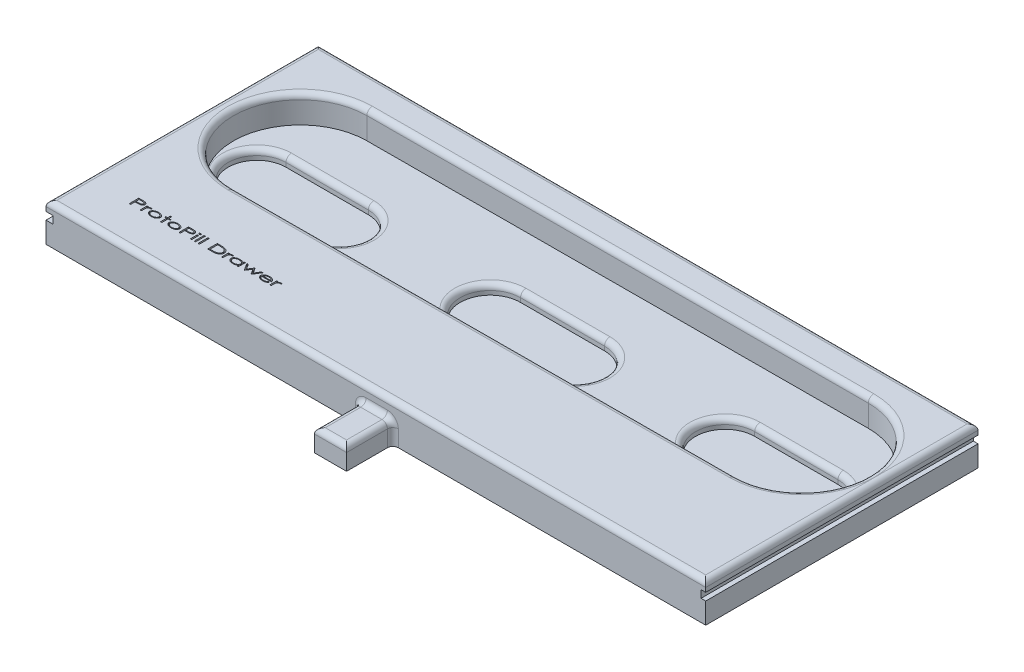
from build123d import *

# Parameters (mm, degrees)
SKETCH1_W           = 242.10193191
SKETCH1_H           = 93
BOSS_EXTRUDE1_DEPTH = 14
SKETCH2_W           = 4.694067914
SKETCH2_H           = 2.762668825
CUT_EXTRUDE1_DEPTH  = 262.793762442
SKETCH7_W           = 11.788952715
SKETCH7_H           = 7.980899871
BOSS_EXTRUDE2_DEPTH = 70
BOSS_EXTRUDE3_DEPTH = 53
CUT_EXTRUDE2_DEPTH  = 10
CUT_EXTRUDE4_DEPTH  = 3.5
FILLET2_R           = 2
FILLET3_R           = 2
SKETCH11_W          = 242.10193191
SKETCH11_H          = 46.073783244
CUT_EXTRUDE5_DEPTH  = 264.730454648
FILLET4_R           = 2
SKETCH12_R          = 3.025
CUT_EXTRUDE6_DEPTH  = 2
SKETCH13_W          = 0.493589743
SKETCH13_H          = 2.557692308
SKETCH13_H_2        = 3.58974359
CUT_EXTRUDE7_DEPTH  = 2
CUT_EXTRUDE8_DEPTH  = 2


with BuildPart() as part:
    # Sketch1 → Boss-Extrude1 (new body)
    with BuildSketch(Plane(origin=(0, 0, 0), x_dir=(1, 0, 0), z_dir=(0, 1, 0))):
        with Locations((123.266397435, 18.180222461)):
            Rectangle(SKETCH1_W, SKETCH1_H)
    extrude(amount=BOSS_EXTRUDE1_DEPTH)

    # Sketch2 → Cut-Extrude1 (cut, through all)
    with BuildSketch(Plane.XY.offset(28.319777539)):
        with Locations((2.347033957, 9.071542246)):
            Rectangle(SKETCH2_W, SKETCH2_H)
    cut_extrude1 = extrude(amount=-CUT_EXTRUDE1_DEPTH, mode=Mode.SUBTRACT)

    # Mirror5: Cut-Extrude1 across plane
    add(cut_extrude1.mirror(Plane(origin=(123.647335387, 0, 0), x_dir=(0, 0, 1), z_dir=(1, 0, 0))), mode=Mode.SUBTRACT)

    # Sketch7 → Boss-Extrude2 (add)
    with BuildSketch(Plane.XY.offset(28.319777539)):
        with Locations((123.619253178, 3.990449936)):
            Rectangle(SKETCH7_W, SKETCH7_H)
    extrude(amount=BOSS_EXTRUDE2_DEPTH)

    # Sketch8 → Boss-Extrude3 (add)
    with BuildSketch(Plane.XY.offset(28.319777539)):
        Polygon((244.31736339, 10.452876658), (244.31736339, 14), (2.21543148, 14), (2.21543148, 10.452876658), (4.694067914, 10.452876658), (4.694067914, 7.690207833), (2.21543148, 7.690207833), (2.21543148, 0), (117.72477682, 0), (117.72477682, 7.980899871), (129.513729535, 7.980899871), (129.513729535, 0), (244.31736339, 0), (244.31736339, 7.690207833), (242.60060286, 7.690207833), (242.60060286, 10.452876658), align=None)
    extrude(amount=BOSS_EXTRUDE3_DEPTH)

    # Sketch9 → Cut-Extrude2 (cut)
    with BuildSketch(Plane(origin=(0, 14, 0), x_dir=(1, 0, 0), z_dir=(0, 1, 0))):
        with BuildLine():
            Line((32.192967626, 6.462131645), (215.586098008, 7.089792499))
            ThreePointArc((215.586098008, 7.089792499), (240.21687673, -17.37296417), (215.754120062, -42.003742891))
            Line((215.754120062, -42.003742891), (32.360989679, -42.631403746))
            ThreePointArc((32.360989679, -42.631403746), (7.730210957, -18.168647077), (32.192967626, 6.462131645))
        make_face()
    extrude(amount=-CUT_EXTRUDE2_DEPTH, mode=Mode.SUBTRACT)

    # Sketch10 → Cut-Extrude4 (cut)
    with BuildSketch(Plane(origin=(0, 4, 0), x_dir=(1, 0, 0), z_dir=(0, 1, 0))):
        with BuildLine():
            Line((22.25591728, -13.271336062), (52.471076918, -13.271336062))
            ThreePointArc((52.471076918, -13.271336062), (63.102678482, -23.902937626), (52.471076918, -34.53453919))
            Line((52.471076918, -34.53453919), (22.25591728, -34.53453919))
            ThreePointArc((22.25591728, -34.53453919), (11.624315716, -23.902937626), (22.25591728, -13.271336062))
        make_face()
        with BuildLine():
            Line((108.253612411, -13.200304135), (139.069681283, -13.200304135))
            ThreePointArc((139.069681283, -13.200304135), (150.155917287, -24.286540139), (139.069681283, -35.372776144))
            Line((139.069681283, -35.372776144), (108.253612411, -35.372776144))
            ThreePointArc((108.253612411, -35.372776144), (97.167376406, -24.286540139), (108.253612411, -13.200304135))
        make_face()
        with BuildLine():
            Line((193.804446674, -12.815543396), (224.338324214, -12.815543396))
            ThreePointArc((224.338324214, -12.815543396), (235.209291929, -23.686511111), (224.338324214, -34.557478826))
            Line((224.338324214, -34.557478826), (193.804446674, -34.557478826))
            ThreePointArc((193.804446674, -34.557478826), (182.933478959, -23.686511111), (193.804446674, -12.815543396))
        make_face()
    extrude(amount=-CUT_EXTRUDE4_DEPTH, mode=Mode.SUBTRACT)

    # Fillet2
    fillet2_edges = [part.edges().sort_by_distance(p)[0] for p in [
        (240.21687673, 14, 17.37296417),
        (124.05755487, 14, 42.317573318),
        (7.730210957, 14, 18.168647077),
        (123.889532817, 14, -6.775962072),
    ]]
    fillet(fillet2_edges, radius=FILLET2_R)

    # Fillet3
    fillet3_edges = [part.edges().sort_by_distance(p)[0] for p in [
        (235.209291929, 4, 23.686511111),
        (209.071385444, 4, 34.557478826),
        (182.933478959, 4, 23.686511111),
        (150.155917287, 4, 24.286540139),
        (123.661646847, 4, 35.372776144),
        (97.167376406, 4, 24.286540139),
        (63.102678482, 4, 23.902937626),
        (37.363497099, 4, 34.53453919),
        (11.624315716, 4, 23.902937626),
        (209.071385444, 4, 12.815543396),
        (123.661646847, 4, 13.200304135),
        (37.363497099, 4, 13.271336062),
    ]]
    fillet(fillet3_edges, radius=FILLET3_R)

    # Sketch11 → Cut-Extrude5 (cut, through all)
    with BuildSketch(Plane(origin=(0, 14, 0), x_dir=(1, 0, 0), z_dir=(0, 1, 0))):
        with Locations((123.266397435, 41.643330839)):
            Rectangle(SKETCH11_W, SKETCH11_H)
    extrude(amount=-CUT_EXTRUDE5_DEPTH, mode=Mode.SUBTRACT)

    # Fillet4
    fillet4_edges = [part.edges().sort_by_distance(p)[0] for p in [
        (117.72477682, 3.990449936, 81.319777539),
        (129.513729535, 3.990449936, 81.319777539),
        (123.619253178, 7.980899871, 98.319777539),
        (117.72477682, 7.980899871, 89.819777539),
        (123.619253178, 7.980899871, 81.319777539),
        (129.513729535, 7.980899871, 89.819777539),
        (244.31736339, 14, 31.356669161),
        (123.266397435, 14, 81.319777539),
        (2.21543148, 14, 31.356669161),
        (123.266397435, 14, -18.606439217),
    ]]
    fillet(fillet4_edges, radius=FILLET4_R)

    # Sketch12 → Cut-Extrude6 (cut)
    with BuildSketch(Plane.XZ):
        with Locations((79.20490952, -2.654606068)):
            Circle(SKETCH12_R)
        with Locations((79.20490952, 6.341887825)):
            Circle(SKETCH12_R)
        with Locations((169.858472383, 5.930696377)):
            Circle(SKETCH12_R)
        with Locations((169.858472383, -2.654606068)):
            Circle(SKETCH12_R)
    extrude(amount=-CUT_EXTRUDE6_DEPTH, mode=Mode.SUBTRACT)

    # Sketch13 → Cut-Extrude7 (cut)
    # profile 1 of 16: a face of its own
    with BuildSketch(Plane(origin=(0, 14, 0), x_dir=(1, 0, 0), z_dir=(0, 1, 0))):
        with BuildLine():
            Line((18.559453652, -63.609154928), (19.589401569, -63.609154928))
            add(Edge.make_bspline(
                [(19.589401569, -63.609154928), (19.660216229, -63.609207816), (19.796009129, -63.609309233), (19.990458636, -63.612311088), (20.166922514, -63.616339403), (20.325381855, -63.621986437), (20.465916911, -63.628417575), (20.588361196, -63.637854069), (20.692806826, -63.647360425), (20.75610385, -63.657252292), (20.784814229, -63.661739063)],
                knots=[0, 0, 0, 0, 1.419177856, 2.721389515, 3.89734153, 4.956527438, 5.899121513, 6.716361902, 7.417765099, 8, 8, 8, 8], degree=3))
            add(Edge.make_bspline(
                [(20.784814229, -63.661739063), (20.820887054, -63.668358554), (20.892034872, -63.681414432), (20.995514197, -63.707401431), (21.093930167, -63.738080351), (21.187023764, -63.77418744), (21.275308065, -63.814482055), (21.358419454, -63.860319671), (21.436467741, -63.910896585), (21.509168984, -63.965877922), (21.575105371, -64.025007934), (21.632608856, -64.088601838), (21.680831646, -64.15611131), (21.721857181, -64.226827444), (21.752422367, -64.301981747), (21.774235543, -64.380809711), (21.788083956, -64.463099368), (21.789502804, -64.519389326), (21.790222883, -64.547957011)],
                knots=[0, 0, 0, 0, 1.202944546, 2.372613736, 3.497786956, 4.582770442, 5.646275108, 6.679186854, 7.693607135, 8.694962411, 9.666642172, 10.595006966, 11.501456956, 12.383984799, 13.271030618, 14.154656858, 15.063470898, 16, 16, 16, 16], degree=3))
            add(Edge.make_bspline(
                [(21.790222883, -64.547957011), (21.789521087, -64.576761689), (21.788143787, -64.633291905), (21.774119081, -64.716000476), (21.752660293, -64.794872573), (21.722045447, -64.869807261), (21.683557714, -64.941214738), (21.635074098, -65.00797268), (21.578906649, -65.07163001), (21.513310562, -65.129978091), (21.440869989, -65.18484635), (21.361600897, -65.235229344), (21.275762005, -65.280811287), (21.183647001, -65.321492741), (21.0849146, -65.357142972), (20.979859337, -65.388653778), (20.867916227, -65.415337146), (20.790732781, -65.429180671), (20.751160383, -65.436278326)],
                knots=[0, 0, 0, 0, 0.922605917, 1.810647271, 2.681294701, 3.538296812, 4.399903948, 5.275180805, 6.177331378, 7.116219832, 8.084190562, 9.088028358, 10.12368074, 11.197019002, 12.313319958, 13.4865942, 14.711362353, 16, 16, 16, 16], degree=3))
            add(Edge.make_bspline(
                [(20.751160383, -65.436278326), (20.718469229, -65.440942875), (20.646706534, -65.451182363), (20.529050496, -65.462594348), (20.392284803, -65.472278622), (20.236346099, -65.479638048), (20.061053197, -65.485869185), (19.866368667, -65.490814558), (19.65227691, -65.493557666), (19.503164369, -65.493697388), (19.425339069, -65.493770313)],
                knots=[0, 0, 0, 0, 0.596701069, 1.309861314, 2.135550679, 3.074303209, 4.130845578, 5.305332262, 6.593590277, 8, 8, 8, 8], degree=3))
            Line((19.425339069, -65.493770313), (19.053043395, -65.493770313))
            Line((19.053043395, -65.493770313), (19.053043395, -67.109154928))
            Line((19.053043395, -67.109154928), (18.559453652, -67.109154928))
            Line((18.559453652, -67.109154928), (18.559453652, -63.609154928))
        make_face()
        with BuildLine():
            Line((19.053043395, -63.968129287), (19.053043395, -65.134795954))
            Line((19.053043395, -65.134795954), (19.953984902, -65.142508294))
            add(Edge.make_bspline(
                [(19.953984902, -65.142508294), (19.99792553, -65.142521334), (20.08301808, -65.142546588), (20.205949603, -65.138570661), (20.319804463, -65.134014923), (20.424328313, -65.127165764), (20.519658494, -65.117805993), (20.606116267, -65.108019692), (20.683188352, -65.094359518), (20.772402579, -65.075649298), (20.871574629, -65.044704061), (20.978955012, -64.998076538), (21.07224247, -64.940131325), (21.152027991, -64.873727987), (21.216190155, -64.800096138), (21.262354089, -64.720428976), (21.291409318, -64.636401283), (21.294894643, -64.578326983), (21.296633139, -64.549359255)],
                knots=[0, 0, 0, 0, 1.302178146, 2.521713123, 3.644833948, 4.679186471, 5.625468095, 6.483724746, 7.256908744, 7.944332482, 9.184328887, 10.328545311, 11.404879146, 12.427406377, 13.395044434, 14.282513672, 15.143309921, 16, 16, 16, 16], degree=3))
            add(Edge.make_bspline(
                [(21.296633139, -64.549359255), (21.29488017, -64.521086999), (21.291349857, -64.464149342), (21.26214629, -64.381617706), (21.216240367, -64.302719484), (21.151826402, -64.230387849), (21.074420468, -64.163622302), (20.983396781, -64.107713567), (20.881682484, -64.060904428), (20.787456502, -64.032245262), (20.703325252, -64.013994903), (20.629883554, -64.00148467), (20.546835613, -63.991071106), (20.454427444, -63.983061843), (20.352767544, -63.975873783), (20.2417168, -63.971162183), (20.121100984, -63.968331153), (20.037420139, -63.968198302), (19.993948844, -63.968129287)],
                knots=[0, 0, 0, 0, 0.85982624, 1.731608922, 2.638175506, 3.627963027, 4.668731374, 5.743984735, 6.872385735, 8.073309669, 8.737023245, 9.49590589, 10.343247817, 11.287432573, 12.322799246, 13.449422509, 14.675002546, 16, 16, 16, 16], degree=3))
            Line((19.993948844, -63.968129287), (19.053043395, -63.968129287))
        make_face(mode=Mode.SUBTRACT)
    # profile 2 of 16: a face of its own
    with BuildSketch(Plane(origin=(0, 14, 0), x_dir=(1, 0, 0), z_dir=(0, 1, 0))):
        with BuildLine():
            Line((22.553043395, -64.55146262), (23.046633139, -64.55146262))
            Line((23.046633139, -64.55146262), (23.046633139, -64.927965024))
            add(Edge.make_bspline(
                [(23.046633139, -64.927965024), (23.082885879, -64.892621444), (23.153638365, -64.823643314), (23.268351063, -64.735386097), (23.385694455, -64.662111951), (23.506193525, -64.604249484), (23.629883275, -64.560946567), (23.755528933, -64.528912548), (23.884155021, -64.510398001), (23.970654507, -64.507865291), (24.014181216, -64.506590826)],
                knots=[0, 0, 0, 0, 1.118950737, 2.183794828, 3.193525129, 4.173720819, 5.133313879, 6.087280825, 7.037516007, 8, 8, 8, 8], degree=3))
            add(Edge.make_bspline(
                [(24.014181216, -64.506590826), (24.047897414, -64.507756469), (24.116628327, -64.510132648), (24.221300531, -64.527311932), (24.329395531, -64.554260942), (24.400953974, -64.580679867), (24.43765878, -64.59423105)],
                knots=[0, 0, 0, 0, 0.930225898, 1.896277749, 2.920927934, 4, 4, 4, 4], degree=3))
            Line((24.43765878, -64.59423105), (24.180347081, -64.866266306))
            add(Edge.make_bspline(
                [(24.180347081, -64.866266306), (24.156566026, -64.8595064), (24.111129946, -64.846590924), (24.045503081, -64.831561132), (23.985450915, -64.822594083), (23.94736645, -64.821303889), (23.929345479, -64.82069339)],
                knots=[0, 0, 0, 0, 1.159041688, 2.214464814, 3.155112748, 4, 4, 4, 4], degree=3))
            add(Edge.make_bspline(
                [(23.929345479, -64.82069339), (23.889948104, -64.822308073), (23.811047254, -64.825541788), (23.694185274, -64.85207983), (23.579705378, -64.894632173), (23.487625223, -64.943250947), (23.416756228, -64.990378929), (23.366448084, -65.031120689), (23.31903889, -65.076135863), (23.275521831, -65.126404123), (23.234924036, -65.180976511), (23.197579829, -65.240229473), (23.163881393, -65.304021263), (23.144708599, -65.348959682), (23.134974485, -65.37177512)],
                knots=[0, 0, 0, 0, 1.378395564, 2.76050325, 4.1743034, 5.645969789, 6.395007641, 7.151651941, 7.909932039, 8.681347296, 9.476827634, 10.289673222, 11.131659355, 12, 12, 12, 12], degree=3))
            add(Edge.make_bspline(
                [(23.134974485, -65.37177512), (23.127503484, -65.391971011), (23.111112, -65.436281085), (23.095135155, -65.512110019), (23.079205605, -65.601073056), (23.068303686, -65.704210737), (23.05820614, -65.820818827), (23.051559556, -65.951306742), (23.047331348, -66.095771336), (23.04687292, -66.196758208), (23.046633139, -66.249579608)],
                knots=[0, 0, 0, 0, 0.582572936, 1.278173338, 2.094113426, 3.030890954, 4.085475449, 5.26463872, 6.569263414, 8, 8, 8, 8], degree=3))
            Line((23.046633139, -66.249579608), (23.046633139, -67.109154928))
            Line((23.046633139, -67.109154928), (22.553043395, -67.109154928))
            Line((22.553043395, -67.109154928), (22.553043395, -64.55146262))
        make_face()
    # profile 3 of 16: a face of its own
    with BuildSketch(Plane(origin=(0, 14, 0), x_dir=(1, 0, 0), z_dir=(0, 1, 0))):
        with BuildLine():
            add(Edge.make_bspline(
                [(26.705787786, -64.506590826), (26.778056125, -64.507620156), (26.919621695, -64.509636499), (27.126898032, -64.530782568), (27.324628677, -64.563483241), (27.513377302, -64.608619596), (27.692408154, -64.66845597), (27.862235557, -64.74094608), (28.023182204, -64.825847595), (28.122431681, -64.894027991), (28.17183346, -64.927965024)],
                knots=[0, 0, 0, 0, 1.118029041, 2.190093497, 3.220499173, 4.217871291, 5.190012594, 6.137901036, 7.073133634, 8, 8, 8, 8], degree=3))
            add(Edge.make_bspline(
                [(28.17183346, -64.927965024), (28.213892898, -64.959851367), (28.295495735, -65.021716578), (28.402860552, -65.125435073), (28.494480251, -65.232803882), (28.5706408, -65.344323998), (28.62815826, -65.461728169), (28.670374378, -65.582809314), (28.695535165, -65.708678755), (28.698822316, -65.794207131), (28.700479293, -65.837319992)],
                knots=[0, 0, 0, 0, 1.156785325, 2.244370538, 3.266277709, 4.248660306, 5.197713603, 6.124949243, 7.054830596, 8, 8, 8, 8], degree=3))
            add(Edge.make_bspline(
                [(28.700479293, -65.837319992), (28.699020086, -65.880703477), (28.696120562, -65.966908882), (28.66788985, -66.09349869), (28.624199892, -66.21614742), (28.562685996, -66.334591252), (28.482768178, -66.448186173), (28.386329221, -66.55792718), (28.271324793, -66.662406192), (28.141405488, -66.762376644), (27.997864786, -66.85478944), (27.842118278, -66.934486584), (27.677093059, -67.00267444), (27.501834157, -67.058149076), (27.316887289, -67.10139543), (27.121923564, -67.13201863), (26.917181777, -67.150431683), (26.777341111, -67.152809862), (26.705787786, -67.154026723)],
                knots=[0, 0, 0, 0, 0.789098804, 1.567983354, 2.350210273, 3.155490411, 3.990287269, 4.874001324, 5.810856407, 6.815460693, 7.856857624, 8.915312001, 9.997439552, 11.105303834, 12.259580059, 13.453399675, 14.696961864, 16, 16, 16, 16], degree=3))
            add(Edge.make_bspline(
                [(26.705787786, -67.154026723), (26.634001021, -67.152802883), (26.493461475, -67.150406928), (26.287787586, -67.132042599), (26.092089603, -67.101519473), (25.90655601, -67.05787591), (25.730646128, -67.002978447), (25.565261375, -66.93445207), (25.409501235, -66.854798449), (25.265964077, -66.762374335), (25.136043872, -66.662406757), (25.021039664, -66.557927043), (24.924600654, -66.448186207), (24.844682849, -66.334591243), (24.783168949, -66.216147422), (24.739478992, -66.093498689), (24.71124828, -65.966908882), (24.708348756, -65.880703477), (24.706889549, -65.837319992)],
                knots=[0, 0, 0, 0, 1.305249044, 2.555333257, 3.751483921, 4.903955647, 6.018189604, 7.098625447, 8.155425126, 9.195194025, 10.198227797, 11.13361828, 12.01595081, 12.849442617, 13.653463848, 14.434467899, 15.212134806, 16, 16, 16, 16], degree=3))
            add(Edge.make_bspline(
                [(24.706889549, -65.837319992), (24.708552832, -65.794438612), (24.711861398, -65.709139906), (24.737074533, -65.583550181), (24.778871813, -65.462378766), (24.837664002, -65.346083449), (24.913193078, -65.234555112), (25.0040698, -65.126875384), (25.112150179, -65.023875406), (25.193526394, -64.962006886), (25.235535383, -64.93006839)],
                knots=[0, 0, 0, 0, 0.94172135, 1.873251586, 2.802131417, 3.750562843, 4.727561346, 5.755201045, 6.841163442, 8, 8, 8, 8], degree=3))
            add(Edge.make_bspline(
                [(25.235535383, -64.93006839), (25.284901741, -64.895839515), (25.383973083, -64.827146974), (25.545486729, -64.742381433), (25.715300151, -64.669073341), (25.89502493, -64.609467936), (26.084251711, -64.563161903), (26.28307383, -64.530923748), (26.491247685, -64.509606196), (26.633283682, -64.507609874), (26.705787786, -64.506590826)],
                knots=[0, 0, 0, 0, 0.925913955, 1.858179155, 2.807793909, 3.776850706, 4.775415181, 5.809663793, 6.881914668, 8, 8, 8, 8], degree=3))
        make_face()
        with BuildLine():
            add(Edge.make_bspline(
                [(26.703684421, -64.82069339), (26.653170058, -64.821651672), (26.553813524, -64.823536516), (26.407422979, -64.837958465), (26.266381666, -64.860892765), (26.13053942, -64.892936964), (26.000513614, -64.935200454), (25.875881416, -64.986660045), (25.756217794, -65.04679942), (25.643966715, -65.116470587), (25.540614354, -65.191698546), (25.450401465, -65.272734905), (25.373244793, -65.356884317), (25.30969161, -65.445275626), (25.26095542, -65.538352301), (25.226535498, -65.63539395), (25.204319933, -65.736059107), (25.201768787, -65.804718817), (25.200479293, -65.839423358)],
                knots=[0, 0, 0, 0, 1.211834855, 2.383553959, 3.525731113, 4.638274302, 5.728838459, 6.802447438, 7.870742288, 8.938271609, 9.968951287, 10.933831991, 11.842871365, 12.70331083, 13.538512719, 14.354385004, 15.168212155, 16, 16, 16, 16], degree=3))
            add(Edge.make_bspline(
                [(25.200479293, -65.839423358), (25.20128811, -65.861880838), (25.202903686, -65.906738615), (25.211779163, -65.973589969), (25.228617652, -66.039026504), (25.249815833, -66.103954003), (25.279245117, -66.166862968), (25.313370433, -66.229252417), (25.355453121, -66.289287174), (25.402115492, -66.348842837), (25.454227927, -66.406224097), (25.512325206, -66.459095498), (25.57354613, -66.510381481), (25.639753494, -66.557531786), (25.710618066, -66.601296414), (25.785477085, -66.641895197), (25.864869786, -66.679042672), (25.977124962, -66.724188783), (26.124887989, -66.770886307), (26.310590114, -66.810534687), (26.504322999, -66.836050577), (26.636529128, -66.838619335), (26.703684421, -66.839924159)],
                knots=[0, 0, 0, 0, 0.676698543, 1.351674039, 2.02606196, 2.70946426, 3.405653627, 4.114679009, 4.848838336, 5.610721482, 6.392982434, 7.180011484, 7.97496537, 8.797371187, 9.625630927, 10.482387151, 11.360987975, 12.264255974, 14.125429088, 16.019773843, 17.978208304, 20, 20, 20, 20], degree=3))
            add(Edge.make_bspline(
                [(26.703684421, -66.839924159), (26.770841079, -66.838623222), (26.903049896, -66.836062115), (27.096763322, -66.810490823), (27.282318068, -66.771090107), (27.429868494, -66.723812046), (27.542331492, -66.679211051), (27.621892969, -66.641887292), (27.696719417, -66.601256356), (27.767572894, -66.557792182), (27.83322779, -66.50991138), (27.895013712, -66.459355254), (27.953174172, -66.406232613), (28.005119145, -66.348566936), (28.052867782, -66.289794691), (28.093633261, -66.22875016), (28.129281063, -66.16732038), (28.157020189, -66.103563808), (28.180038595, -66.039332866), (28.194990878, -65.973378644), (28.205663819, -65.906846209), (28.206480891, -65.861902107), (28.206889549, -65.839423358)],
                knots=[0, 0, 0, 0, 2.021608502, 3.979865511, 5.874038621, 7.728335502, 8.638053201, 9.516574416, 10.373253009, 11.201437702, 12.018055674, 12.818372735, 13.605330473, 14.387520545, 15.15371191, 15.883845854, 16.596257792, 17.289495649, 17.975116066, 18.647787728, 19.323692347, 20, 20, 20, 20], degree=3))
            add(Edge.make_bspline(
                [(28.206889549, -65.839423358), (28.205604326, -65.804716578), (28.203061631, -65.736052439), (28.180783686, -65.63541998), (28.146565943, -65.538150381), (28.09683336, -65.445470458), (28.033463413, -65.356873821), (27.956213394, -65.272527733), (27.865310898, -65.191705357), (27.761397088, -65.116662108), (27.649064475, -65.046774554), (27.529379625, -64.986666237), (27.404752744, -64.935200672), (27.274727078, -64.892929588), (27.139103341, -64.860975962), (26.998549546, -64.837944566), (26.852854913, -64.82353935), (26.753964996, -64.821652671), (26.703684421, -64.82069339)],
                knots=[0, 0, 0, 0, 0.832069071, 1.646171375, 2.462319504, 3.300417048, 4.161147425, 5.070494144, 6.03988092, 7.075430977, 8.143321227, 9.211977265, 10.285949229, 11.376882104, 12.489801441, 13.626829931, 14.793361768, 16, 16, 16, 16], degree=3))
        make_face(mode=Mode.SUBTRACT)
    # profile 4 of 16: a face of its own
    with BuildSketch(Plane(origin=(0, 14, 0), x_dir=(1, 0, 0), z_dir=(0, 1, 0))):
        Polygon((30.046633139, -63.519411338), (30.540222883, -63.519411338), (30.540222883, -64.55146262), (31.303043395, -64.55146262), (31.303043395, -64.865565185), (30.540222883, -64.865565185), (30.540222883, -67.109154928), (30.046633139, -67.109154928), (30.046633139, -64.865565185), (29.373556216, -64.865565185), (29.373556216, -64.55146262), (30.046633139, -64.55146262), align=None)
    # profile 5 of 16: a face of its own
    with BuildSketch(Plane(origin=(0, 14, 0), x_dir=(1, 0, 0), z_dir=(0, 1, 0))):
        with BuildLine():
            add(Edge.make_bspline(
                [(33.840403171, -64.506590826), (33.91267151, -64.507620156), (34.054237079, -64.509636499), (34.261513416, -64.530782568), (34.459244062, -64.563483241), (34.647992687, -64.608619596), (34.827023539, -64.66845597), (34.996850942, -64.74094608), (35.157797589, -64.825847595), (35.257047065, -64.894027991), (35.306448844, -64.927965024)],
                knots=[0, 0, 0, 0, 1.118029041, 2.190093497, 3.220499173, 4.217871291, 5.190012594, 6.137901036, 7.073133634, 8, 8, 8, 8], degree=3))
            add(Edge.make_bspline(
                [(35.306448844, -64.927965024), (35.348508282, -64.959851367), (35.430111119, -65.021716578), (35.537475937, -65.125435073), (35.629095636, -65.232803882), (35.705256185, -65.344323998), (35.762773644, -65.461728169), (35.804989762, -65.582809314), (35.83015055, -65.708678755), (35.833437701, -65.794207131), (35.835094678, -65.837319992)],
                knots=[0, 0, 0, 0, 1.156785325, 2.244370538, 3.266277709, 4.248660306, 5.197713603, 6.124949243, 7.054830596, 8, 8, 8, 8], degree=3))
            add(Edge.make_bspline(
                [(35.835094678, -65.837319992), (35.833635471, -65.880703477), (35.830735946, -65.966908882), (35.802505235, -66.09349869), (35.758815277, -66.21614742), (35.697301381, -66.334591252), (35.617383562, -66.448186173), (35.520944606, -66.55792718), (35.405940177, -66.662406192), (35.276020873, -66.762376644), (35.13248017, -66.85478944), (34.976733663, -66.934486584), (34.811708444, -67.00267444), (34.636449541, -67.058149076), (34.451502674, -67.10139543), (34.256538949, -67.13201863), (34.051797161, -67.150431683), (33.911956496, -67.152809862), (33.840403171, -67.154026723)],
                knots=[0, 0, 0, 0, 0.789098804, 1.567983354, 2.350210273, 3.155490411, 3.990287269, 4.874001324, 5.810856407, 6.815460693, 7.856857624, 8.915312001, 9.997439552, 11.105303834, 12.259580059, 13.453399675, 14.696961864, 16, 16, 16, 16], degree=3))
            add(Edge.make_bspline(
                [(33.840403171, -67.154026723), (33.768616406, -67.152802883), (33.62807686, -67.150406928), (33.422402971, -67.132042599), (33.226704988, -67.101519473), (33.041171394, -67.05787591), (32.865261513, -67.002978447), (32.699876759, -66.93445207), (32.544116619, -66.854798449), (32.400579462, -66.762374335), (32.270659257, -66.662406757), (32.155655049, -66.557927043), (32.059216039, -66.448186207), (31.979298233, -66.334591243), (31.917784334, -66.216147422), (31.874094377, -66.093498689), (31.845863665, -65.966908882), (31.84296414, -65.880703477), (31.841504934, -65.837319992)],
                knots=[0, 0, 0, 0, 1.305249044, 2.555333257, 3.751483921, 4.903955647, 6.018189604, 7.098625447, 8.155425126, 9.195194025, 10.198227797, 11.13361828, 12.01595081, 12.849442617, 13.653463848, 14.434467899, 15.212134806, 16, 16, 16, 16], degree=3))
            add(Edge.make_bspline(
                [(31.841504934, -65.837319992), (31.843168217, -65.794438612), (31.846476782, -65.709139906), (31.871689918, -65.583550181), (31.913487198, -65.462378766), (31.972279386, -65.346083449), (32.047808463, -65.234555112), (32.138685185, -65.126875384), (32.246765564, -65.023875406), (32.328141779, -64.962006886), (32.370150767, -64.93006839)],
                knots=[0, 0, 0, 0, 0.94172135, 1.873251586, 2.802131417, 3.750562843, 4.727561346, 5.755201045, 6.841163442, 8, 8, 8, 8], degree=3))
            add(Edge.make_bspline(
                [(32.370150767, -64.93006839), (32.419517126, -64.895839515), (32.518588467, -64.827146974), (32.680102113, -64.742381433), (32.849915535, -64.669073341), (33.029640315, -64.609467936), (33.218867096, -64.563161903), (33.417689214, -64.530923748), (33.62586307, -64.509606196), (33.767899067, -64.507609874), (33.840403171, -64.506590826)],
                knots=[0, 0, 0, 0, 0.925913955, 1.858179155, 2.807793909, 3.776850706, 4.775415181, 5.809663793, 6.881914668, 8, 8, 8, 8], degree=3))
        make_face()
        with BuildLine():
            add(Edge.make_bspline(
                [(33.838299806, -64.82069339), (33.787785443, -64.821651672), (33.688428909, -64.823536516), (33.542038364, -64.837958465), (33.400997051, -64.860892765), (33.265154804, -64.892936964), (33.135128999, -64.935200454), (33.010496801, -64.986660045), (32.890833179, -65.04679942), (32.7785821, -65.116470587), (32.675229739, -65.191698546), (32.585016849, -65.272734905), (32.507860177, -65.356884317), (32.444306995, -65.445275626), (32.395570804, -65.538352301), (32.361150883, -65.63539395), (32.338935317, -65.736059107), (32.336384172, -65.804718817), (32.335094678, -65.839423358)],
                knots=[0, 0, 0, 0, 1.211834855, 2.383553959, 3.525731113, 4.638274302, 5.728838459, 6.802447438, 7.870742288, 8.938271609, 9.968951287, 10.933831991, 11.842871365, 12.70331083, 13.538512719, 14.354385004, 15.168212155, 16, 16, 16, 16], degree=3))
            add(Edge.make_bspline(
                [(32.335094678, -65.839423358), (32.335903495, -65.861880838), (32.337519071, -65.906738615), (32.346394547, -65.973589969), (32.363233036, -66.039026504), (32.384431218, -66.103954003), (32.413860502, -66.166862968), (32.447985817, -66.229252417), (32.490068505, -66.289287174), (32.536730877, -66.348842837), (32.588843311, -66.406224097), (32.646940591, -66.459095498), (32.708161514, -66.510381481), (32.774368878, -66.557531786), (32.84523345, -66.601296414), (32.920092469, -66.641895197), (32.999485171, -66.679042672), (33.111740347, -66.724188783), (33.259503373, -66.770886307), (33.445205499, -66.810534687), (33.638938383, -66.836050577), (33.771144513, -66.838619335), (33.838299806, -66.839924159)],
                knots=[0, 0, 0, 0, 0.676698543, 1.351674039, 2.02606196, 2.70946426, 3.405653627, 4.114679009, 4.848838336, 5.610721482, 6.392982434, 7.180011484, 7.97496537, 8.797371187, 9.625630927, 10.482387151, 11.360987975, 12.264255974, 14.125429088, 16.019773843, 17.978208304, 20, 20, 20, 20], degree=3))
            add(Edge.make_bspline(
                [(33.838299806, -66.839924159), (33.905456464, -66.838623222), (34.03766528, -66.836062115), (34.231378706, -66.810490823), (34.416933453, -66.771090107), (34.564483879, -66.723812046), (34.676946876, -66.679211051), (34.756508354, -66.641887292), (34.831334801, -66.601256356), (34.902188279, -66.557792182), (34.967843174, -66.50991138), (35.029629097, -66.459355254), (35.087789556, -66.406232613), (35.13973453, -66.348566936), (35.187483167, -66.289794691), (35.228248646, -66.22875016), (35.263896448, -66.16732038), (35.291635574, -66.103563808), (35.314653979, -66.039332866), (35.329606263, -65.973378644), (35.340279203, -65.906846209), (35.341096276, -65.861902107), (35.341504934, -65.839423358)],
                knots=[0, 0, 0, 0, 2.021608502, 3.979865511, 5.874038621, 7.728335502, 8.638053201, 9.516574416, 10.373253009, 11.201437702, 12.018055674, 12.818372735, 13.605330473, 14.387520545, 15.15371191, 15.883845854, 16.596257792, 17.289495649, 17.975116066, 18.647787728, 19.323692347, 20, 20, 20, 20], degree=3))
            add(Edge.make_bspline(
                [(35.341504934, -65.839423358), (35.340219711, -65.804716578), (35.337677016, -65.736052439), (35.31539907, -65.63541998), (35.281181328, -65.538150381), (35.231448744, -65.445470458), (35.168078797, -65.356873821), (35.090828779, -65.272527733), (34.999926282, -65.191705357), (34.896012472, -65.116662108), (34.78367986, -65.046774554), (34.663995009, -64.986666237), (34.539368128, -64.935200672), (34.409342463, -64.892929588), (34.273718725, -64.860975962), (34.133164931, -64.837944566), (33.987470297, -64.82353935), (33.88858038, -64.821652671), (33.838299806, -64.82069339)],
                knots=[0, 0, 0, 0, 0.832069071, 1.646171375, 2.462319504, 3.300417048, 4.161147425, 5.070494144, 6.03988092, 7.075430977, 8.143321227, 9.211977265, 10.285949229, 11.376882104, 12.489801441, 13.626829931, 14.793361768, 16, 16, 16, 16], degree=3))
        make_face(mode=Mode.SUBTRACT)
    # profile 6 of 16: a face of its own
    with BuildSketch(Plane(origin=(0, 14, 0), x_dir=(1, 0, 0), z_dir=(0, 1, 0))):
        with BuildLine():
            Line((36.822274165, -63.609154928), (37.852222081, -63.609154928))
            add(Edge.make_bspline(
                [(37.852222081, -63.609154928), (37.923036742, -63.609207816), (38.058829642, -63.609309233), (38.253279149, -63.612311088), (38.429743027, -63.616339403), (38.588202368, -63.621986437), (38.728737424, -63.628417575), (38.851181709, -63.637854069), (38.955627339, -63.647360425), (39.018924363, -63.657252292), (39.047634742, -63.661739063)],
                knots=[0, 0, 0, 0, 1.419177856, 2.721389515, 3.89734153, 4.956527438, 5.899121513, 6.716361902, 7.417765099, 8, 8, 8, 8], degree=3))
            add(Edge.make_bspline(
                [(39.047634742, -63.661739063), (39.083707567, -63.668358554), (39.154855385, -63.681414432), (39.25833471, -63.707401431), (39.35675068, -63.738080351), (39.449844277, -63.77418744), (39.538128578, -63.814482055), (39.621239966, -63.860319671), (39.699288254, -63.910896585), (39.771989497, -63.965877922), (39.837925884, -64.025007934), (39.895429369, -64.088601838), (39.943652158, -64.15611131), (39.984677694, -64.226827444), (40.01524288, -64.301981747), (40.037056055, -64.380809711), (40.050904469, -64.463099368), (40.052323317, -64.519389326), (40.053043395, -64.547957011)],
                knots=[0, 0, 0, 0, 1.202944546, 2.372613736, 3.497786956, 4.582770442, 5.646275108, 6.679186854, 7.693607135, 8.694962411, 9.666642172, 10.595006966, 11.501456956, 12.383984799, 13.271030618, 14.154656858, 15.063470898, 16, 16, 16, 16], degree=3))
            add(Edge.make_bspline(
                [(40.053043395, -64.547957011), (40.0523416, -64.576761689), (40.0509643, -64.633291905), (40.036939593, -64.716000476), (40.015480806, -64.794872573), (39.984865959, -64.869807261), (39.946378227, -64.941214738), (39.897894611, -65.00797268), (39.841727161, -65.07163001), (39.776131075, -65.129978091), (39.703690502, -65.18484635), (39.62442141, -65.235229344), (39.538582518, -65.280811287), (39.446467514, -65.321492741), (39.347735113, -65.357142972), (39.24267985, -65.388653778), (39.130736739, -65.415337146), (39.053553293, -65.429180671), (39.013980895, -65.436278326)],
                knots=[0, 0, 0, 0, 0.922605917, 1.810647271, 2.681294701, 3.538296812, 4.399903948, 5.275180805, 6.177331378, 7.116219832, 8.084190562, 9.088028358, 10.12368074, 11.197019002, 12.313319958, 13.4865942, 14.711362353, 16, 16, 16, 16], degree=3))
            add(Edge.make_bspline(
                [(39.013980895, -65.436278326), (38.981289742, -65.440942875), (38.909527047, -65.451182363), (38.791871009, -65.462594348), (38.655105316, -65.472278622), (38.499166612, -65.479638048), (38.32387371, -65.485869185), (38.12918918, -65.490814558), (37.915097422, -65.493557666), (37.765984882, -65.493697388), (37.688159581, -65.493770313)],
                knots=[0, 0, 0, 0, 0.596701069, 1.309861314, 2.135550679, 3.074303209, 4.130845578, 5.305332262, 6.593590277, 8, 8, 8, 8], degree=3))
            Line((37.688159581, -65.493770313), (37.315863908, -65.493770313))
            Line((37.315863908, -65.493770313), (37.315863908, -67.109154928))
            Line((37.315863908, -67.109154928), (36.822274165, -67.109154928))
            Line((36.822274165, -67.109154928), (36.822274165, -63.609154928))
        make_face()
        with BuildLine():
            Line((37.315863908, -63.968129287), (37.315863908, -65.134795954))
            Line((37.315863908, -65.134795954), (38.216805415, -65.142508294))
            add(Edge.make_bspline(
                [(38.216805415, -65.142508294), (38.260746043, -65.142521334), (38.345838593, -65.142546588), (38.468770116, -65.138570661), (38.582624975, -65.134014923), (38.687148826, -65.127165764), (38.782479007, -65.117805993), (38.86893678, -65.108019692), (38.946008865, -65.094359518), (39.035223092, -65.075649298), (39.134395142, -65.044704061), (39.241775524, -64.998076538), (39.335062983, -64.940131325), (39.414848504, -64.873727987), (39.479010668, -64.800096138), (39.525174602, -64.720428976), (39.554229831, -64.636401283), (39.557715156, -64.578326983), (39.559453652, -64.549359255)],
                knots=[0, 0, 0, 0, 1.302178146, 2.521713123, 3.644833948, 4.679186471, 5.625468095, 6.483724746, 7.256908744, 7.944332482, 9.184328887, 10.328545311, 11.404879146, 12.427406377, 13.395044434, 14.282513672, 15.143309921, 16, 16, 16, 16], degree=3))
            add(Edge.make_bspline(
                [(39.559453652, -64.549359255), (39.557700683, -64.521086999), (39.554170369, -64.464149342), (39.524966803, -64.381617706), (39.47906088, -64.302719484), (39.414646915, -64.230387849), (39.337240981, -64.163622302), (39.246217293, -64.107713567), (39.144502997, -64.060904428), (39.050277015, -64.032245262), (38.966145765, -64.013994903), (38.892704067, -64.00148467), (38.809656126, -63.991071106), (38.717247957, -63.983061843), (38.615588056, -63.975873783), (38.504537313, -63.971162183), (38.383921497, -63.968331153), (38.300240652, -63.968198302), (38.256769357, -63.968129287)],
                knots=[0, 0, 0, 0, 0.85982624, 1.731608922, 2.638175506, 3.627963027, 4.668731374, 5.743984735, 6.872385735, 8.073309669, 8.737023245, 9.49590589, 10.343247817, 11.287432573, 12.322799246, 13.449422509, 14.675002546, 16, 16, 16, 16], degree=3))
            Line((38.256769357, -63.968129287), (37.315863908, -63.968129287))
        make_face(mode=Mode.SUBTRACT)
    # profile 7 of 16: a face of its own
    with BuildSketch(Plane(origin=(0, 14, 0), x_dir=(1, 0, 0), z_dir=(0, 1, 0))):
        with BuildLine():
            add(Edge.make_bspline(
                [(41.195170799, -63.474539544), (41.223742293, -63.475444808), (41.279186456, -63.47720151), (41.359164795, -63.491819245), (41.432178837, -63.517540909), (41.497355041, -63.551134641), (41.552523123, -63.591527922), (41.592788877, -63.638471284), (41.619361021, -63.690084533), (41.622163424, -63.7268835), (41.623556216, -63.745172556)],
                knots=[0, 0, 0, 0, 1.232622349, 2.391954591, 3.492533549, 4.561789548, 5.54829387, 6.421376584, 7.215425493, 8, 8, 8, 8], degree=3))
            add(Edge.make_bspline(
                [(41.623556216, -63.745172556), (41.622129336, -63.762989159), (41.619237592, -63.79909666), (41.592764511, -63.849828547), (41.552271135, -63.896017197), (41.497388245, -63.936437233), (41.43216936, -63.969990798), (41.359167501, -63.995723927), (41.279185714, -64.010338417), (41.22374204, -64.01209558), (41.195170799, -64.013001082)],
                knots=[0, 0, 0, 0, 0.768134372, 1.55671721, 2.426123539, 3.417176527, 4.491362752, 5.597016362, 6.761694161, 8, 8, 8, 8], degree=3))
            add(Edge.make_bspline(
                [(41.195170799, -64.013001082), (41.167299701, -64.012088189), (41.113015682, -64.010310165), (41.034441435, -63.995641492), (40.962203204, -63.969837117), (40.897154989, -63.936450047), (40.842278337, -63.896014323), (40.80178356, -63.849829196), (40.775310798, -63.799096509), (40.772419013, -63.762989109), (40.770992113, -63.745172556)],
                knots=[0, 0, 0, 0, 1.217058856, 2.370442829, 3.474794704, 4.557074952, 5.555595552, 6.431552882, 7.226077714, 8, 8, 8, 8], degree=3))
            add(Edge.make_bspline(
                [(40.770992113, -63.745172556), (40.772384926, -63.726883552), (40.77518737, -63.690084689), (40.801759191, -63.638470624), (40.842026358, -63.59153082), (40.897188205, -63.551121842), (40.962193812, -63.517694669), (41.034444082, -63.491901625), (41.113014965, -63.477229785), (41.167299458, -63.475452207), (41.195170799, -63.474539544)],
                knots=[0, 0, 0, 0, 0.790458961, 1.590463383, 2.470094379, 3.463997666, 4.541273283, 5.640518464, 6.788569012, 8, 8, 8, 8], degree=3))
        make_face()
    # profile 8 of 16: a face of its own
    with BuildSketch(Plane(origin=(0, 14, 0), x_dir=(1, 0, 0), z_dir=(0, 1, 0))):
        with Locations((41.197274165, -65.830308774)):
            Rectangle(SKETCH13_W, SKETCH13_H)
    # profile 9 of 16: a face of its own
    with BuildSketch(Plane(origin=(0, 14, 0), x_dir=(1, 0, 0), z_dir=(0, 1, 0))):
        with Locations((42.633171601, -65.314283133)):
            Rectangle(SKETCH13_W, SKETCH13_H_2)
    # profile 10 of 16: a face of its own
    with BuildSketch(Plane(origin=(0, 14, 0), x_dir=(1, 0, 0), z_dir=(0, 1, 0))):
        with Locations((44.069069037, -65.314283133)):
            Rectangle(SKETCH13_W, SKETCH13_H_2)
    # profile 11 of 16: a face of its own
    with BuildSketch(Plane(origin=(0, 14, 0), x_dir=(1, 0, 0), z_dir=(0, 1, 0))):
        with BuildLine():
            Line((47.36714596, -67.109154928), (47.36714596, -63.609154928))
            Line((47.36714596, -63.609154928), (48.438460062, -63.609154928))
            add(Edge.make_bspline(
                [(48.438460062, -63.609154928), (48.531712009, -63.609594491), (48.711689613, -63.610442853), (48.971851243, -63.615895212), (49.212171661, -63.625396635), (49.432590558, -63.639513457), (49.633032827, -63.656451712), (49.813573226, -63.678081235), (49.974404016, -63.703247199), (50.074263118, -63.725097127), (50.12115237, -63.735356851)],
                knots=[0, 0, 0, 0, 1.323813521, 2.554979188, 3.693909684, 4.737789415, 5.690279757, 6.54911815, 7.318732465, 8, 8, 8, 8], degree=3))
            add(Edge.make_bspline(
                [(50.12115237, -63.735356851), (50.182360785, -63.750727059), (50.302289439, -63.780842662), (50.47510584, -63.837934848), (50.63743565, -63.903410911), (50.790380521, -63.975703775), (50.931875258, -64.058538865), (51.064820416, -64.147100164), (51.186111181, -64.245737983), (51.297114502, -64.351616929), (51.396649223, -64.463823474), (51.482778392, -64.582568992), (51.556053676, -64.706153808), (51.616102467, -64.835272179), (51.66268865, -64.96989436), (51.695126289, -65.109985297), (51.716599116, -65.254959753), (51.718664648, -65.353468165), (51.719710062, -65.403325601)],
                knots=[0, 0, 0, 0, 1.207798654, 2.366499211, 3.480576359, 4.557146755, 5.601517647, 6.616536575, 7.612203728, 8.589979544, 9.55040618, 10.479294148, 11.393893687, 12.296620384, 13.200709655, 14.115506133, 15.04621312, 16, 16, 16, 16], degree=3))
            add(Edge.make_bspline(
                [(51.719710062, -65.403325601), (51.71893028, -65.44662001), (51.717390347, -65.532118874), (51.70024112, -65.657973096), (51.674873544, -65.780195858), (51.637216344, -65.898018322), (51.590084674, -66.012342778), (51.53255743, -66.122909801), (51.463341196, -66.228750322), (51.38472431, -66.330215054), (51.298266291, -66.426557074), (51.204295017, -66.516438037), (51.105296567, -66.600746353), (50.998948774, -66.677434843), (50.887067496, -66.74843722), (50.768192025, -66.811937669), (50.643543087, -66.869819765), (50.511351032, -66.921417693), (50.369248869, -66.966514904), (50.214925451, -67.005008441), (50.047228204, -67.036725523), (49.865936723, -67.063218635), (49.671362091, -67.084174925), (49.463202803, -67.098401362), (49.241800204, -67.107872409), (49.089579057, -67.108719292), (49.011276569, -67.109154928)],
                knots=[0, 0, 0, 0, 0.867583375, 1.713324997, 2.542387203, 3.367932116, 4.189477015, 5.019531976, 5.863128609, 6.721742731, 7.591172003, 8.456207664, 9.327453716, 10.196390289, 11.083089667, 11.982588127, 12.896750361, 13.837492442, 14.826032314, 15.884199514, 17.024778466, 18.246884326, 19.557235698, 20.947863052, 22.429982155, 24, 24, 24, 24], degree=3))
            Line((49.011276569, -67.109154928), (47.36714596, -67.109154928))
        make_face()
        with BuildLine():
            Line((47.860735703, -66.750180569), (48.463700447, -66.750180569))
            add(Edge.make_bspline(
                [(48.463700447, -66.750180569), (48.550407656, -66.749934964), (48.716821888, -66.749463582), (48.95616186, -66.745259824), (49.174708879, -66.738427089), (49.37271188, -66.728874591), (49.549883598, -66.71619384), (49.706396613, -66.702106612), (49.842167294, -66.684499735), (49.925133013, -66.668512174), (49.963399966, -66.661138101)],
                knots=[0, 0, 0, 0, 1.383279688, 2.654882197, 3.818759855, 4.871481191, 5.817166586, 6.652292251, 7.378385793, 8, 8, 8, 8], degree=3))
            add(Edge.make_bspline(
                [(49.963399966, -66.661138101), (50.011186753, -66.649900503), (50.105041787, -66.62782944), (50.241009103, -66.587803159), (50.36838981, -66.539255854), (50.488739138, -66.486822737), (50.600589123, -66.425799165), (50.70498325, -66.359779234), (50.801333549, -66.286791684), (50.889427588, -66.207922208), (50.968761515, -66.123588853), (51.03706997, -66.033750412), (51.095875592, -65.940178438), (51.144034391, -65.841593247), (51.180096557, -65.737828321), (51.207238232, -65.63024341), (51.222644147, -65.51781855), (51.224948247, -65.441464821), (51.226120319, -65.402624479)],
                knots=[0, 0, 0, 0, 1.213921113, 2.384186417, 3.50166985, 4.583183161, 5.627935832, 6.649229357, 7.63522774, 8.613403315, 9.570260051, 10.49386413, 11.399942308, 12.29947164, 13.200651912, 14.111784984, 15.039484809, 16, 16, 16, 16], degree=3))
            add(Edge.make_bspline(
                [(51.226120319, -65.402624479), (51.225164489, -65.361653507), (51.223281928, -65.280958781), (51.204746311, -65.162709599), (51.177133933, -65.048797063), (51.136823711, -64.939456945), (51.084560482, -64.834968598), (51.021777525, -64.734416325), (50.947039959, -64.639039909), (50.861283864, -64.54852776), (50.765322475, -64.46414008), (50.660407906, -64.385833697), (50.546112391, -64.315173186), (50.423418459, -64.250271267), (50.290797228, -64.193980968), (50.149854108, -64.143152042), (49.999496542, -64.100679796), (49.89575075, -64.077907524), (49.842807017, -64.066286338)],
                knots=[0, 0, 0, 0, 0.937479559, 1.846420823, 2.734195072, 3.61797647, 4.508263293, 5.405088182, 6.327834881, 7.277997599, 8.256154844, 9.250457072, 10.272077141, 11.330106498, 12.425583743, 13.568150063, 14.758974123, 16, 16, 16, 16], degree=3))
            add(Edge.make_bspline(
                [(49.842807017, -64.066286338), (49.798702837, -64.058152015), (49.704301647, -64.040741196), (49.551849118, -64.022169849), (49.38002734, -64.005402586), (49.18833763, -63.991414461), (48.976757528, -63.981340846), (48.74536129, -63.973768644), (48.494105175, -63.968655685), (48.319973182, -63.968309238), (48.229525767, -63.968129287)],
                knots=[0, 0, 0, 0, 0.664968389, 1.423307427, 2.276521454, 3.225252385, 4.273249474, 5.41763715, 6.658672415, 8, 8, 8, 8], degree=3))
            Line((48.229525767, -63.968129287), (47.860735703, -63.968129287))
            Line((47.860735703, -63.968129287), (47.860735703, -66.750180569))
        make_face(mode=Mode.SUBTRACT)
    # profile 12 of 16: a face of its own
    with BuildSketch(Plane(origin=(0, 14, 0), x_dir=(1, 0, 0), z_dir=(0, 1, 0))):
        with BuildLine():
            Line((52.43765878, -64.55146262), (52.931248524, -64.55146262))
            Line((52.931248524, -64.55146262), (52.931248524, -64.927965024))
            add(Edge.make_bspline(
                [(52.931248524, -64.927965024), (52.967501264, -64.892621444), (53.03825375, -64.823643314), (53.152966447, -64.735386097), (53.270309839, -64.662111951), (53.39080891, -64.604249484), (53.51449866, -64.560946567), (53.640144318, -64.528912548), (53.768770406, -64.510398001), (53.855269892, -64.507865291), (53.898796601, -64.506590826)],
                knots=[0, 0, 0, 0, 1.118950737, 2.183794828, 3.193525129, 4.173720819, 5.133313879, 6.087280825, 7.037516007, 8, 8, 8, 8], degree=3))
            add(Edge.make_bspline(
                [(53.898796601, -64.506590826), (53.932512798, -64.507756469), (54.001243711, -64.510132648), (54.105915916, -64.527311932), (54.214010916, -64.554260942), (54.285569359, -64.580679867), (54.322274165, -64.59423105)],
                knots=[0, 0, 0, 0, 0.930225898, 1.896277749, 2.920927934, 4, 4, 4, 4], degree=3))
            Line((54.322274165, -64.59423105), (54.064962466, -64.866266306))
            add(Edge.make_bspline(
                [(54.064962466, -64.866266306), (54.04118141, -64.8595064), (53.99574533, -64.846590924), (53.930118466, -64.831561132), (53.8700663, -64.822594083), (53.831981835, -64.821303889), (53.813960863, -64.82069339)],
                knots=[0, 0, 0, 0, 1.159041688, 2.214464814, 3.155112748, 4, 4, 4, 4], degree=3))
            add(Edge.make_bspline(
                [(53.813960863, -64.82069339), (53.774563489, -64.822308073), (53.695662639, -64.825541788), (53.578800659, -64.85207983), (53.464320762, -64.894632173), (53.372240607, -64.943250947), (53.301371612, -64.990378929), (53.251063469, -65.031120689), (53.203654275, -65.076135863), (53.160137216, -65.126404123), (53.119539421, -65.180976511), (53.082195214, -65.240229473), (53.048496778, -65.304021263), (53.029323984, -65.348959682), (53.01958987, -65.37177512)],
                knots=[0, 0, 0, 0, 1.378395564, 2.76050325, 4.1743034, 5.645969789, 6.395007641, 7.151651941, 7.909932039, 8.681347296, 9.476827634, 10.289673222, 11.131659355, 12, 12, 12, 12], degree=3))
            add(Edge.make_bspline(
                [(53.01958987, -65.37177512), (53.012118868, -65.391971011), (52.995727384, -65.436281085), (52.97975054, -65.512110019), (52.963820989, -65.601073056), (52.952919071, -65.704210737), (52.942821525, -65.820818827), (52.936174941, -65.951306742), (52.931946732, -66.095771336), (52.931488305, -66.196758208), (52.931248524, -66.249579608)],
                knots=[0, 0, 0, 0, 0.582572936, 1.278173338, 2.094113426, 3.030890954, 4.085475449, 5.26463872, 6.569263414, 8, 8, 8, 8], degree=3))
            Line((52.931248524, -66.249579608), (52.931248524, -67.109154928))
            Line((52.931248524, -67.109154928), (52.43765878, -67.109154928))
            Line((52.43765878, -67.109154928), (52.43765878, -64.55146262))
        make_face()
    # profile 13 of 16: a face of its own
    with BuildSketch(Plane(origin=(0, 14, 0), x_dir=(1, 0, 0), z_dir=(0, 1, 0))):
        with BuildLine():
            Line((58.629966472, -64.55146262), (58.629966472, -67.109154928))
            Line((58.629966472, -67.109154928), (58.136376729, -67.109154928))
            Line((58.136376729, -67.109154928), (58.136376729, -66.666747076))
            add(Edge.make_bspline(
                [(58.136376729, -66.666747076), (58.083405025, -66.707144972), (57.977740519, -66.787728067), (57.80516538, -66.888334084), (57.623576286, -66.973052459), (57.432019869, -67.040222741), (57.23150627, -67.091139072), (57.022160476, -67.127216323), (56.803840868, -67.150570325), (56.654967572, -67.152860788), (56.579185222, -67.154026723)],
                knots=[0, 0, 0, 0, 0.959950057, 1.9148459, 2.87384884, 3.846004085, 4.837560737, 5.853778905, 6.907489231, 8, 8, 8, 8], degree=3))
            add(Edge.make_bspline(
                [(56.579185222, -67.154026723), (56.511834357, -67.15281249), (56.379452071, -67.150425841), (56.184595544, -67.131673367), (55.997367817, -67.101949123), (55.817336407, -67.059734305), (55.644987842, -67.005276263), (55.480074165, -66.9381943), (55.322411488, -66.859814105), (55.174528406, -66.769213218), (55.038813222, -66.671014904), (54.919093167, -66.566671181), (54.818569116, -66.455680116), (54.735700408, -66.339672541), (54.671016296, -66.218093368), (54.625010515, -66.09118191), (54.596619229, -65.95893555), (54.593219728, -65.868776207), (54.591504934, -65.823297556)],
                knots=[0, 0, 0, 0, 1.226021397, 2.409820796, 3.560528837, 4.675169253, 5.773241012, 6.84782229, 7.91342823, 8.975196037, 10.001589918, 10.960246305, 11.860978357, 12.721634312, 13.549600474, 14.359895992, 15.172690086, 16, 16, 16, 16], degree=3))
            add(Edge.make_bspline(
                [(54.591504934, -65.823297556), (54.593250564, -65.77875867), (54.596720224, -65.690232002), (54.624839457, -65.560131313), (54.671970306, -65.435271195), (54.737055308, -65.315614638), (54.820162251, -65.200830653), (54.922486921, -65.091848358), (55.042735011, -64.987633697), (55.179593468, -64.889779885), (55.32894941, -64.80019106), (55.487797498, -64.721723646), (55.653795233, -64.654555584), (55.827808982, -64.60104822), (56.008748713, -64.55793434), (56.197417144, -64.528002604), (56.393285918, -64.510456485), (56.526331604, -64.507892922), (56.59390878, -64.506590826)],
                knots=[0, 0, 0, 0, 0.810112008, 1.610200051, 2.409779071, 3.23202922, 4.082076825, 4.982045036, 5.946842608, 6.973913408, 8.040473165, 9.113409892, 10.195590852, 11.296150651, 12.423889662, 13.578489405, 14.770055223, 16, 16, 16, 16], degree=3))
            add(Edge.make_bspline(
                [(56.59390878, -64.506590826), (56.671553579, -64.508040068), (56.823694877, -64.510879789), (57.04602767, -64.534002364), (57.256890349, -64.573565992), (57.424657527, -64.618589097), (57.552918238, -64.662502718), (57.645129823, -64.70052421), (57.734240862, -64.743688682), (57.820961072, -64.790064138), (57.904322652, -64.841912414), (57.984944422, -64.897910003), (58.062794342, -64.958645051), (58.111850294, -65.002695828), (58.136376729, -65.024719832)],
                knots=[0, 0, 0, 0, 1.676518641, 3.285058718, 4.820346399, 6.305438499, 7.031660956, 7.746785142, 8.457855071, 9.169193615, 9.869488998, 10.576517448, 11.288303459, 12, 12, 12, 12], degree=3))
            Line((58.136376729, -65.024719832), (58.136376729, -64.55146262))
            Line((58.136376729, -64.55146262), (58.629966472, -64.55146262))
        make_face()
        with BuildLine():
            add(Edge.make_bspline(
                [(56.612839069, -64.82069339), (56.54522419, -64.822321038), (56.412111003, -64.825525385), (56.216342831, -64.850522536), (56.028387984, -64.891868097), (55.878199338, -64.939962954), (55.763663038, -64.985602899), (55.682751928, -65.023700461), (55.606230752, -65.064798365), (55.534665585, -65.11002267), (55.466996408, -65.157661521), (55.403774714, -65.208736038), (55.345417031, -65.263785808), (55.291625533, -65.321524741), (55.243692312, -65.381527442), (55.201048158, -65.442114807), (55.164850461, -65.503812834), (55.136655089, -65.567185612), (55.112641083, -65.630551755), (55.096629327, -65.695267224), (55.08746877, -65.760868379), (55.085886683, -65.804807091), (55.085094678, -65.826803165)],
                knots=[0, 0, 0, 0, 2.015899916, 3.96869549, 5.874422764, 7.747889721, 8.664177198, 9.549623601, 10.413438996, 11.252669112, 12.072577075, 12.880219075, 13.67403036, 14.463085208, 15.231525746, 15.962352479, 16.671215476, 17.360484384, 18.02856856, 18.689489262, 19.343947753, 20, 20, 20, 20], degree=3))
            add(Edge.make_bspline(
                [(55.085094678, -65.826803165), (55.085833407, -65.848571438), (55.087318112, -65.892321507), (55.097367439, -65.957400377), (55.113830259, -66.021850188), (55.135923213, -66.085749502), (55.166181395, -66.148450478), (55.201622763, -66.210824288), (55.244410458, -66.27224131), (55.29283022, -66.332738955), (55.347740152, -66.390555294), (55.406503497, -66.446069556), (55.469875698, -66.49822646), (55.53797748, -66.5464638), (55.610649849, -66.591487653), (55.687613135, -66.633475517), (55.769098206, -66.672047462), (55.883753255, -66.718796776), (56.03311856, -66.768112251), (56.21968193, -66.809040151), (56.412039074, -66.835263678), (56.542641418, -66.838359765), (56.608632338, -66.839924159)],
                knots=[0, 0, 0, 0, 0.649936462, 1.30624811, 1.961259946, 2.63442162, 3.32119113, 4.037021866, 4.774532588, 5.553782938, 6.348626026, 7.153333487, 7.966439378, 8.797143028, 9.643383336, 10.517785088, 11.413671548, 12.333773708, 14.213980314, 16.101747765, 18.030286096, 20, 20, 20, 20], degree=3))
            add(Edge.make_bspline(
                [(56.608632338, -66.839924159), (56.67554496, -66.838271112), (56.80818627, -66.834994266), (57.004389282, -66.80990737), (57.195128412, -66.768499351), (57.349031871, -66.720370508), (57.466541306, -66.673267964), (57.550356527, -66.636701353), (57.628265265, -66.595622922), (57.70126492, -66.55241439), (57.769096322, -66.505966049), (57.831163973, -66.456240302), (57.888689726, -66.404133199), (57.940251135, -66.348825326), (57.98681256, -66.291451256), (58.026966839, -66.231630197), (58.060715762, -66.169875557), (58.088026149, -66.106386527), (58.110211285, -66.041577096), (58.125513901, -65.974620072), (58.134935582, -65.905834559), (58.135894384, -65.859318555), (58.136376729, -65.835917749)],
                knots=[0, 0, 0, 0, 1.987519312, 3.939871941, 5.865572077, 7.78042679, 8.721641852, 9.626132954, 10.495705138, 11.336384455, 12.1452667, 12.935762171, 13.69752979, 14.449103521, 15.179961946, 15.89055288, 16.586543186, 17.267584541, 17.941653079, 18.61871876, 19.305118843, 20, 20, 20, 20], degree=3))
            add(Edge.make_bspline(
                [(58.136376729, -65.835917749), (58.135008398, -65.800529391), (58.132303015, -65.730561601), (58.111308137, -65.627853637), (58.076916412, -65.529558157), (58.027589897, -65.436273487), (57.965269952, -65.347198242), (57.888941192, -65.26271342), (57.798227258, -65.18365748), (57.69584081, -65.109019706), (57.582930781, -65.042241329), (57.463465135, -64.98173894), (57.336914789, -64.932433403), (57.20423694, -64.891692233), (57.065410655, -64.859111541), (56.919986866, -64.837538343), (56.76856802, -64.822546688), (56.665461935, -64.821319644), (56.612839069, -64.82069339)],
                knots=[0, 0, 0, 0, 0.838952033, 1.658726862, 2.475797891, 3.301530857, 4.153550984, 5.048566245, 5.995133624, 7.00310499, 8.049891089, 9.103583459, 10.176296665, 11.267009123, 12.393921279, 13.555125413, 14.752194814, 16, 16, 16, 16], degree=3))
        make_face(mode=Mode.SUBTRACT)
    # profile 14 of 16: a face of its own
    with BuildSketch(Plane(origin=(0, 14, 0), x_dir=(1, 0, 0), z_dir=(0, 1, 0))):
        Polygon((59.168428011, -64.55146262), (59.705487306, -64.55146262), (60.851120319, -66.39120621), (62.039521761, -64.55146262), (62.184653972, -64.55146262), (63.363940831, -66.39120621), (64.520791793, -64.55146262), (65.046633139, -64.55146262), (63.43755862, -67.109154928), (63.286817434, -67.109154928), (62.107530575, -65.269411338), (60.918428011, -67.109154928), (60.760675607, -67.109154928), align=None)
    # profile 15 of 16: a face of its own
    with BuildSketch(Plane(origin=(0, 14, 0), x_dir=(1, 0, 0), z_dir=(0, 1, 0))):
        with BuildLine():
            Line((68.893688428, -66.30146262), (69.309453652, -66.447997076))
            add(Edge.make_bspline(
                [(69.309453652, -66.447997076), (69.274884665, -66.487713482), (69.206416741, -66.566376473), (69.091567689, -66.671708984), (68.969767922, -66.766204963), (68.838885073, -66.847610237), (68.700589377, -66.918691618), (68.554160943, -66.980262727), (68.39964479, -67.033638274), (68.236224653, -67.078019434), (68.063082921, -67.112224054), (67.879494566, -67.136466122), (67.684969556, -67.151402251), (67.551535272, -67.153136418), (67.483031376, -67.154026723)],
                knots=[0, 0, 0, 0, 0.935356925, 1.852583867, 2.764980882, 3.672151338, 4.588182607, 5.526468892, 6.493453783, 7.492196994, 8.534274985, 9.628299183, 10.782391289, 12, 12, 12, 12], degree=3))
            add(Edge.make_bspline(
                [(67.483031376, -67.154026723), (67.407269446, -67.152878803), (67.259704281, -67.150642943), (67.044912918, -67.131500306), (66.842699414, -67.100210592), (66.653135426, -67.056485422), (66.476036367, -66.999511393), (66.311478459, -66.930420142), (66.159628267, -66.848118962), (66.022276581, -66.753575529), (65.899472402, -66.651529286), (65.791386806, -66.545811525), (65.700056535, -66.436079246), (65.625891502, -66.322574737), (65.567691224, -66.206180371), (65.52558956, -66.086443498), (65.500371806, -65.962941272), (65.497027577, -65.87926671), (65.495351088, -65.837319992)],
                knots=[0, 0, 0, 0, 1.379293914, 2.686517258, 3.92274962, 5.102580987, 6.224936263, 7.306161049, 8.347779058, 9.364054048, 10.337164078, 11.251934907, 12.113353819, 12.931306227, 13.715381605, 14.47711699, 15.236566735, 16, 16, 16, 16], degree=3))
            add(Edge.make_bspline(
                [(65.495351088, -65.837319992), (65.496705512, -65.79797015), (65.499401676, -65.719638958), (65.520945591, -65.603816289), (65.557452393, -65.491646884), (65.606517575, -65.382078076), (65.671137252, -65.276541361), (65.74985067, -65.174561771), (65.841749048, -65.075094846), (65.911666053, -65.014483141), (65.947574645, -64.983353646)],
                knots=[0, 0, 0, 0, 0.944293904, 1.879744906, 2.816641919, 3.770901605, 4.755300812, 5.779894712, 6.859778713, 8, 8, 8, 8], degree=3))
            add(Edge.make_bspline(
                [(65.947574645, -64.983353646), (65.996639135, -64.94519058), (66.095310623, -64.868442477), (66.257642412, -64.770798247), (66.43275374, -64.689862974), (66.61904679, -64.621976588), (66.81784959, -64.570855719), (67.028154171, -64.532492246), (67.250988606, -64.51123075), (67.403528306, -64.508162024), (67.481629133, -64.506590826)],
                knots=[0, 0, 0, 0, 0.909396737, 1.828848728, 2.765573699, 3.729890337, 4.727376251, 5.766908938, 6.856650047, 8, 8, 8, 8], degree=3))
            add(Edge.make_bspline(
                [(67.481629133, -64.506590826), (67.562087966, -64.507930462), (67.719169985, -64.510545871), (67.948369394, -64.53501625), (68.165261492, -64.573927042), (68.370037916, -64.628296506), (68.562486293, -64.699091744), (68.741902747, -64.786571951), (68.909821653, -64.888648648), (69.011340187, -64.969622466), (69.061957658, -65.009996274)],
                knots=[0, 0, 0, 0, 1.139620897, 2.224913567, 3.261470301, 4.259030804, 5.222856815, 6.161738278, 7.08343673, 8, 8, 8, 8], degree=3))
            add(Edge.make_bspline(
                [(69.061957658, -65.009996274), (69.095537781, -65.039962547), (69.161255559, -65.098607861), (69.247646474, -65.196217238), (69.319821617, -65.300010751), (69.381017961, -65.408286043), (69.428284648, -65.522729781), (69.461742588, -65.642808095), (69.48341614, -65.768317413), (69.487079709, -65.85405903), (69.488940831, -65.897616467)],
                knots=[0, 0, 0, 0, 1.060847693, 2.076125639, 3.065487378, 4.037719101, 5.004010916, 5.977679051, 6.972644549, 8, 8, 8, 8], degree=3))
            Line((69.488940831, -65.897616467), (65.988940831, -65.897616467))
            add(Edge.make_bspline(
                [(65.988940831, -65.897616467), (65.991271696, -65.931399169), (65.995884814, -65.998260011), (66.01921079, -66.095525499), (66.053493821, -66.188365484), (66.101092313, -66.276061964), (66.161550663, -66.35869277), (66.234197045, -66.436619365), (66.319298703, -66.50980119), (66.41542177, -66.578073299), (66.521532383, -66.638778753), (66.633837639, -66.693085983), (66.752439705, -66.738939783), (66.877250676, -66.775789032), (67.007991913, -66.80460958), (67.144608564, -66.824534624), (67.287161541, -66.837685288), (67.38437659, -66.839168018), (67.433952851, -66.839924159)],
                knots=[0, 0, 0, 0, 0.853309836, 1.688823266, 2.513736016, 3.345012842, 4.197955707, 5.091062549, 6.027630919, 7.025902121, 8.061795113, 9.109059866, 10.171494079, 11.26687929, 12.390234416, 13.54715085, 14.74913306, 16, 16, 16, 16], degree=3))
            add(Edge.make_bspline(
                [(67.433952851, -66.839924159), (67.482585942, -66.839314172), (67.579049537, -66.838104264), (67.72276208, -66.826448902), (67.864092415, -66.807586731), (68.002134168, -66.781721149), (68.134095989, -66.750294886), (68.256987111, -66.712026552), (68.370030281, -66.670674395), (68.475062507, -66.622347067), (68.577189059, -66.563980609), (68.679428572, -66.489923094), (68.787661317, -66.403245795), (68.857285108, -66.336408828), (68.893688428, -66.30146262)],
                knots=[0, 0, 0, 0, 1.093367176, 2.168690603, 3.239652219, 4.298164291, 5.325470396, 6.287891767, 7.190798283, 8.030193578, 8.884717855, 9.830992595, 10.86591825, 12, 12, 12, 12], degree=3))
        make_face()
        with BuildLine():
            add(Edge.make_bspline(
                [(68.995351088, -65.583513903), (68.97750516, -65.541606991), (68.942613566, -65.459672393), (68.872852274, -65.348038881), (68.791856015, -65.249574516), (68.697933242, -65.164066836), (68.590819333, -65.088870012), (68.468567863, -65.022412009), (68.330586977, -64.963848285), (68.17895648, -64.913773823), (68.01803554, -64.871458528), (67.850729158, -64.842870096), (67.679572637, -64.823393071), (67.563949829, -64.821600221), (67.505467274, -64.82069339)],
                knots=[0, 0, 0, 0, 0.92011432, 1.798968077, 2.651730975, 3.491490357, 4.359703351, 5.292647224, 6.300626296, 7.38733791, 8.520067401, 9.662460721, 10.817661747, 12, 12, 12, 12], degree=3))
            add(Edge.make_bspline(
                [(67.505467274, -64.82069339), (67.457535626, -64.821293072), (67.363404904, -64.82247076), (67.224786768, -64.833927885), (67.09163835, -64.852920278), (66.963080501, -64.878444027), (66.840187822, -64.913277864), (66.721495897, -64.953536416), (66.608544978, -65.002507081), (66.536956402, -65.041261541), (66.501460863, -65.060477044)],
                knots=[0, 0, 0, 0, 1.101754776, 2.163684692, 3.194775476, 4.192630449, 5.1742102, 6.129121442, 7.072368164, 8, 8, 8, 8], degree=3))
            add(Edge.make_bspline(
                [(66.501460863, -65.060477044), (66.476385079, -65.07544537), (66.426488102, -65.10523005), (66.357206772, -65.157909985), (66.291574849, -65.214541458), (66.230841704, -65.277274705), (66.175790512, -65.346347519), (66.124491151, -65.419967852), (66.077503337, -65.498921947), (66.051332921, -65.554990425), (66.038019357, -65.583513903)],
                knots=[0, 0, 0, 0, 0.985213069, 1.960423394, 2.93349289, 3.909979084, 4.903153156, 5.912153346, 6.937858655, 8, 8, 8, 8], degree=3))
            Line((66.038019357, -65.583513903), (68.995351088, -65.583513903))
        make_face(mode=Mode.SUBTRACT)
    # profile 16 of 16: a face of its own
    with BuildSketch(Plane(origin=(0, 14, 0), x_dir=(1, 0, 0), z_dir=(0, 1, 0))):
        with BuildLine():
            Line((70.162017754, -64.55146262), (70.655607498, -64.55146262))
            Line((70.655607498, -64.55146262), (70.655607498, -64.927965024))
            add(Edge.make_bspline(
                [(70.655607498, -64.927965024), (70.691860238, -64.892621444), (70.762612724, -64.823643314), (70.877325422, -64.735386097), (70.994668813, -64.662111951), (71.115167884, -64.604249484), (71.238857634, -64.560946567), (71.364503292, -64.528912548), (71.49312938, -64.510398001), (71.579628866, -64.507865291), (71.623155575, -64.506590826)],
                knots=[0, 0, 0, 0, 1.118950737, 2.183794828, 3.193525129, 4.173720819, 5.133313879, 6.087280825, 7.037516007, 8, 8, 8, 8], degree=3))
            add(Edge.make_bspline(
                [(71.623155575, -64.506590826), (71.656871773, -64.507756469), (71.725602686, -64.510132648), (71.83027489, -64.527311932), (71.93836989, -64.554260942), (72.009928333, -64.580679867), (72.046633139, -64.59423105)],
                knots=[0, 0, 0, 0, 0.930225898, 1.896277749, 2.920927934, 4, 4, 4, 4], degree=3))
            Line((72.046633139, -64.59423105), (71.78932144, -64.866266306))
            add(Edge.make_bspline(
                [(71.78932144, -64.866266306), (71.765540385, -64.8595064), (71.720104305, -64.846590924), (71.65447744, -64.831561132), (71.594425274, -64.822594083), (71.556340809, -64.821303889), (71.538319838, -64.82069339)],
                knots=[0, 0, 0, 0, 1.159041688, 2.214464814, 3.155112748, 4, 4, 4, 4], degree=3))
            add(Edge.make_bspline(
                [(71.538319838, -64.82069339), (71.498922463, -64.822308073), (71.420021613, -64.825541788), (71.303159633, -64.85207983), (71.188679737, -64.894632173), (71.096599582, -64.943250947), (71.025730587, -64.990378929), (70.975422443, -65.031120689), (70.928013249, -65.076135863), (70.88449619, -65.126404123), (70.843898395, -65.180976511), (70.806554188, -65.240229473), (70.772855752, -65.304021263), (70.753682958, -65.348959682), (70.743948844, -65.37177512)],
                knots=[0, 0, 0, 0, 1.378395564, 2.76050325, 4.1743034, 5.645969789, 6.395007641, 7.151651941, 7.909932039, 8.681347296, 9.476827634, 10.289673222, 11.131659355, 12, 12, 12, 12], degree=3))
            add(Edge.make_bspline(
                [(70.743948844, -65.37177512), (70.736477843, -65.391971011), (70.720086359, -65.436281085), (70.704109514, -65.512110019), (70.688179964, -65.601073056), (70.677278045, -65.704210737), (70.667180499, -65.820818827), (70.660533915, -65.951306742), (70.656305707, -66.095771336), (70.655847279, -66.196758208), (70.655607498, -66.249579608)],
                knots=[0, 0, 0, 0, 0.582572936, 1.278173338, 2.094113426, 3.030890954, 4.085475449, 5.26463872, 6.569263414, 8, 8, 8, 8], degree=3))
            Line((70.655607498, -66.249579608), (70.655607498, -67.109154928))
            Line((70.655607498, -67.109154928), (70.162017754, -67.109154928))
            Line((70.162017754, -67.109154928), (70.162017754, -64.55146262))
        make_face()
    extrude(amount=-CUT_EXTRUDE7_DEPTH, mode=Mode.SUBTRACT)

    # Sketch14 → Cut-Extrude8 (cut)
    with BuildSketch(Plane.XZ):
        Polygon((76.147523237, 6.139331249), (79.172523237, 12.817811701), (82.197523237, 6.139331249), align=None)
        Polygon((76.147523237, -2.857162644), (79.172523237, -9.535643097), (82.197523237, -2.857162644), align=None)
        Polygon((166.8010861, 5.728139801), (169.8260861, 12.406620254), (172.8510861, 5.728139801), align=None)
        Polygon((166.8010861, -2.857162644), (169.8260861, -9.535643097), (172.8510861, -2.857162644), align=None)
    extrude(amount=-CUT_EXTRUDE8_DEPTH, mode=Mode.SUBTRACT)


solid = part.part
